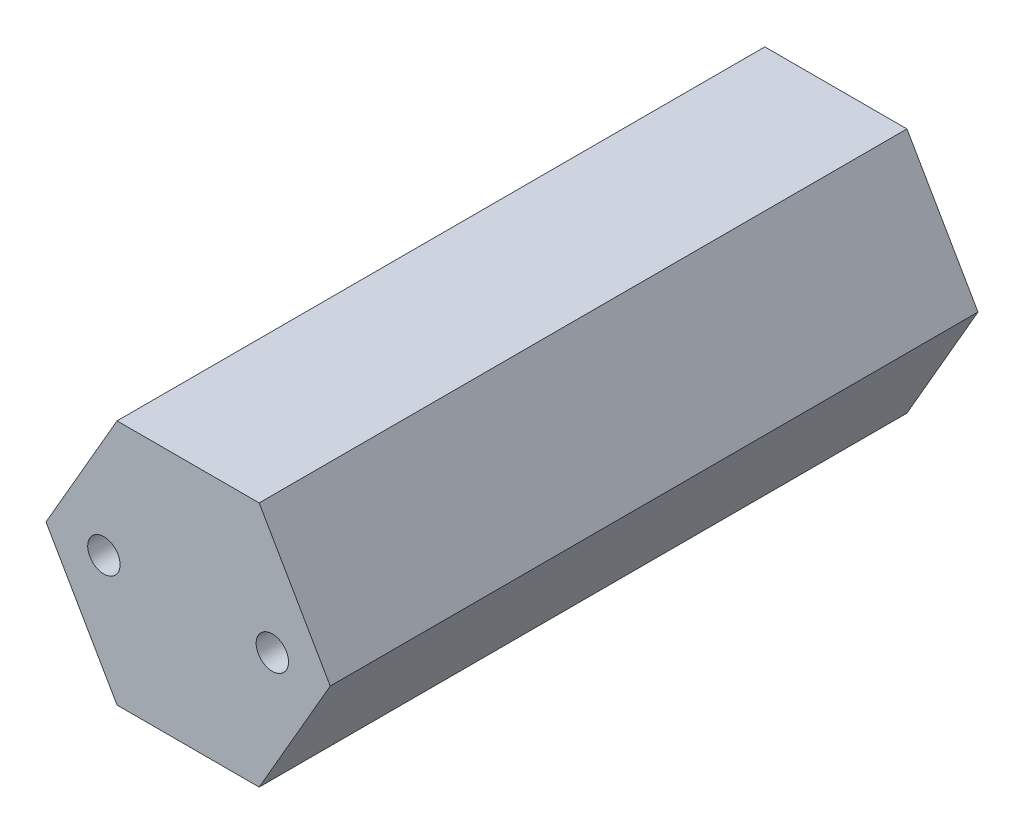
from build123d import *

# Parameters (mm, degrees)
SKETCH1_R           = 1.25
BOSS_EXTRUDE1_DEPTH = 50


with BuildPart() as part:
    # Sketch1 → Boss-Extrude1 (new body)
    with BuildSketch(Plane.XY):
        Polygon((-5.484827557, -9.5), (5.484827557, -9.5), (10.969655115, 0), (5.484827557, 9.5), (-5.484827557, 9.5), (-10.969655115, 0), align=None)
        with Locations((-6.5, 0)):
            Circle(SKETCH1_R, mode=Mode.SUBTRACT)
        with Locations((6.5, 0)):
            Circle(SKETCH1_R, mode=Mode.SUBTRACT)
    extrude(amount=BOSS_EXTRUDE1_DEPTH)


solid = part.part
